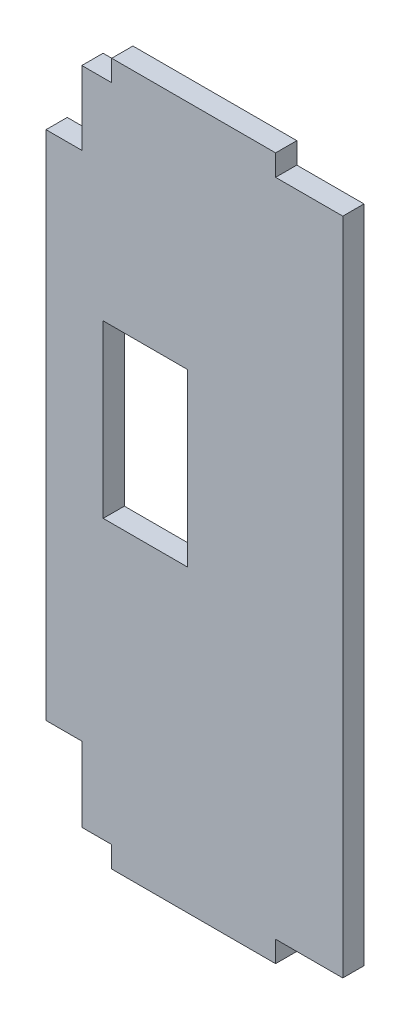
from build123d import *

# Parameters (mm, degrees)
SKETCH1_W           = 7.1882
SKETCH1_H           = 14.5542
BOSS_EXTRUDE1_DEPTH = 1.8034


with BuildPart() as part:
    # Sketch1 → Boss-Extrude1 (new body)
    with BuildSketch(Plane.XY):
        Polygon((-17.4498, -1.8034), (-17.4498, -8.056080365), (-20.4978, -8.056080365), (-20.4978, -51.5874), (-17.4498, -51.5874), (-17.4498, -57.9374), (-14.9098, -57.9374), (-14.9098, -59.7408), (-0.9652, -59.7408), (-0.9652, -57.9374), (4.7498, -57.9374), (4.7498, -1.8034), (-0.9652, -1.8034), (-0.9652, 0), (-14.9098, 0), (-14.9098, -1.8034), align=None)
        with Locations((-12.0396, -26.9875)):
            Rectangle(SKETCH1_W, SKETCH1_H, mode=Mode.SUBTRACT)
    extrude(amount=BOSS_EXTRUDE1_DEPTH)


solid = part.part
